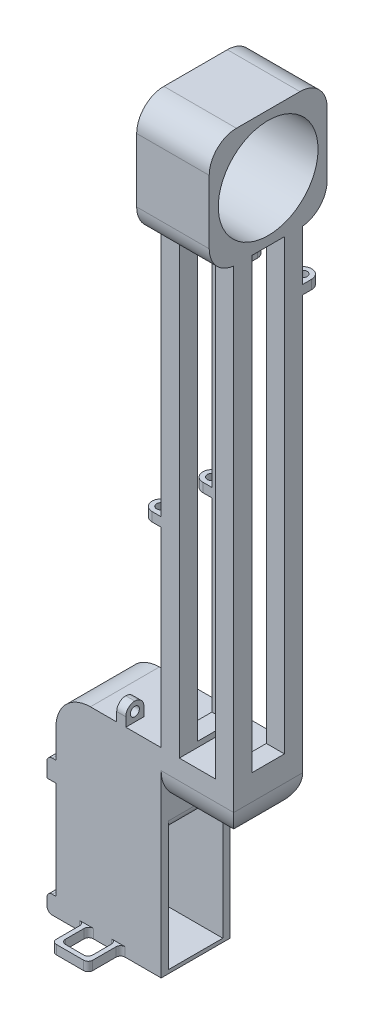
from build123d import *

# Parameters (mm, degrees)
SKETCH1_W              = 65
SKETCH1_H              = 65
SKETCH1_R              = 27.5
SKETCH1_W_2            = 38
SKETCH1_H_2            = 280
BOSS_EXTRUDE1_DEPTH    = 40
FILLET1_R              = 15
SKETCH2_W              = 58
SKETCH2_H              = 100
BOSS_EXTRUDE2_DEPTH    = 38
FILLET2_R              = 19
SKETCH3_W              = 20
SKETCH3_H              = 250
CUT_EXTRUDE1_DEPTH     = 38
SKETCH4_W              = 18
SKETCH4_H              = 247.009867417
CUT_EXTRUDE2_DEPTH     = 92
SKETCH5_W              = 28
SKETCH5_H              = 60
CUT_EXTRUDE3_DEPTH     = 58
SKETCH6_W              = 38
SKETCH6_H              = 3
BOSS_EXTRUDE11_DEPTH   = 5
BOSS_EXTRUDE11_2_DEPTH = 5
FILLET3_R              = 3
FILLET4_R              = 3
SKETCH7_W              = 10
SKETCH7_H              = 5
BOSS_EXTRUDE14_DEPTH   = 10
SKETCH8_R              = 2.5
CUT_EXTRUDE4_DEPTH     = 10
FILLET5_R              = 5
SKETCH9_W              = 10
SKETCH9_H              = 5
BOSS_EXTRUDE15_DEPTH   = 10
FILLET6_R              = 5
SKETCH10_R             = 2.5
CUT_EXTRUDE5_DEPTH     = 10
SKETCH11_W             = 5
SKETCH11_H             = 10
BOSS_EXTRUDE16_DEPTH   = 10
FILLET7_R              = 5
SKETCH12_R             = 2.5
CUT_EXTRUDE7_DEPTH     = 10
FILLET9_R              = 2
SKETCH13_W             = 35.831314296
SKETCH13_H             = 60.586089769
CUT_EXTRUDE8_DEPTH     = 10
SKETCH14_W             = 58
SKETCH14_H             = 38
CUT_EXTRUDE9_DEPTH     = 70
SKETCH15_W             = 58
SKETCH15_H             = 38
BOSS_EXTRUDE17_DEPTH   = 80
SKETCH16_W             = 34
SKETCH16_H             = 70
CUT_EXTRUDE10_DEPTH    = 58
SKETCH17_W             = 5
SKETCH17_H             = 38
BOSS_EXTRUDE18_DEPTH   = 5
SKETCH18_W             = 38
SKETCH18_H             = 10
BOSS_EXTRUDE19_DEPTH   = 5
FILLET10_R             = 3
FILLET11_R             = 5
SKETCH19_W             = 2
SKETCH19_H             = 75
BOSS_EXTRUDE22_DEPTH   = 58
SKETCH26_W             = 30
SKETCH26_H             = 9
BOSS_EXTRUDE23_DEPTH   = 58
FILLET12_R             = 5
SKETCH27_W             = 5
SKETCH27_H             = 38
BOSS_EXTRUDE24_DEPTH   = 3
BOSS_EXTRUDE26_DEPTH   = 5
FILLET13_R             = 2.5
FILLET14_R             = 2.5


# Some blends are built 0.0001 mm under size
with BuildPart() as part:
    # Sketch1 → Boss-Extrude1 (new body)
    # profile 1 of 2: a face of its own
    with BuildSketch(Plane(origin=(0, 0, 0), x_dir=(0, 0, -1), z_dir=(1, 0, 0))):
        with Locations((-32.5, -32.5)):
            Rectangle(SKETCH1_W, SKETCH1_H)
        with Locations((-32.5, -32.5)):
            Circle(SKETCH1_R, mode=Mode.SUBTRACT)
    # profile 2 of 2: a face of its own
    with BuildSketch(Plane(origin=(0, 0, 0), x_dir=(0, 0, -1), z_dir=(1, 0, 0))):
        with Locations((-32.5, -205)):
            Rectangle(SKETCH1_W_2, SKETCH1_H_2)
    extrude(amount=BOSS_EXTRUDE1_DEPTH)

    # Fillet1
    # the kernel refuses this fillet: 15 mm, written as the material it takes off along each edge
    with BuildSketch(Plane(origin=(-37.312028891, -65, 0), x_dir=(0, 1, 0), z_dir=(1, 0, 0))) as fillet1_piece_1:
        with BuildLine():
            CenterArc((14.924811557, 15), FILLET1_R, 185.739170477, 84.260829523)
            Line((0, 13.5), (-0.298496231, 13.47))
            ThreePointArc((-0.298496231, 13.47), (-0.3, 6.75), (-0.3, 0))
            Line((-0.3, 0), (0, -0.3))
            Line((0, -0.3), (14.924811557, -0.3))
            Line((14.924811557, -0.3), (14.924811557, 0))
        make_face()
    extrude(amount=114.624057783, mode=Mode.SUBTRACT)
    with BuildSketch(Plane(origin=(-37.312028891, -65, 65), x_dir=(0, 1, 0), z_dir=(1, 0, 0))) as fillet1_piece_2:
        with BuildLine():
            CenterArc((14.924811557, -15), FILLET1_R, 90, 84.260829523)
            Line((0, -13.5), (-0.298496231, -13.47))
            ThreePointArc((-0.298496231, -13.47), (-0.3, -6.75), (-0.3, 0))
            Line((-0.3, 0), (0, 0.3))
            Line((0, 0.3), (14.924811557, 0.3))
            Line((14.924811557, 0.3), (14.924811557, 0))
        make_face()
    extrude(amount=114.624057783, mode=Mode.SUBTRACT)
    with BuildSketch(Plane(origin=(-37.5, 0, 0), x_dir=(0, 0, 1), z_dir=(1, 0, 0))) as fillet1_piece_3:
        with BuildLine():
            CenterArc((FILLET1_R, FILLET1_R), FILLET1_R, 180, 90)
            Line((0, FILLET1_R), (-FILLET1_R * 0.02, FILLET1_R))
            Line((-FILLET1_R * 0.02, FILLET1_R), (-FILLET1_R * 0.02, -FILLET1_R * 0.02))
            Line((-FILLET1_R * 0.02, -FILLET1_R * 0.02), (FILLET1_R, -FILLET1_R * 0.02))
            Line((FILLET1_R, -FILLET1_R * 0.02), (FILLET1_R, 0))
        make_face()
    extrude(amount=115, mode=Mode.SUBTRACT)
    with BuildSketch(Plane(origin=(-37.5, 0, 65), x_dir=(0, 0, -1), z_dir=(1, 0, 0))) as fillet1_piece_4:
        with BuildLine():
            CenterArc((FILLET1_R, -FILLET1_R), FILLET1_R, 90, 90)
            Line((0, -FILLET1_R), (-FILLET1_R * 0.02, -FILLET1_R))
            Line((-FILLET1_R * 0.02, -FILLET1_R), (-FILLET1_R * 0.02, FILLET1_R * 0.02))
            Line((-FILLET1_R * 0.02, FILLET1_R * 0.02), (FILLET1_R, FILLET1_R * 0.02))
            Line((FILLET1_R, FILLET1_R * 0.02), (FILLET1_R, 0))
        make_face()
    extrude(amount=115, mode=Mode.SUBTRACT)

    # Sketch2 → Boss-Extrude2 (add)
    with BuildSketch(Plane.XY.offset(51.5)):
        with Locations((-29, -365)):
            Rectangle(SKETCH2_W, SKETCH2_H)
    extrude(amount=-BOSS_EXTRUDE2_DEPTH)

    # Fillet2
    # the kernel refuses this fillet: 19 mm, written as the material it adds along each edge
    # the kernel refuses this fillet: 19 mm, written as the material it takes off along each edge
    with BuildSketch(Plane(origin=(0, -345, 13.5), x_dir=(0, 1, 0), z_dir=(1, 0, 0))) as fillet2_2_piece_1:
        with BuildLine():
            CenterArc((FILLET2_R, FILLET2_R), FILLET2_R, 180, 90)
            Line((0, FILLET2_R), (0, 0))
            Line((0, 0), (FILLET2_R, 0))
        make_face()
    extrude(amount=87.5, mode=Mode.SUBTRACT)
    with BuildSketch(Plane(origin=(0, -345, 51.5), x_dir=(0, 1, 0), z_dir=(1, 0, 0))) as fillet2_2_piece_2:
        with BuildLine():
            CenterArc((FILLET2_R, -FILLET2_R), FILLET2_R, 90, 90)
            Line((0, -FILLET2_R), (0, 0))
            Line((0, 0), (FILLET2_R, 0))
        make_face()
    extrude(amount=87.5, mode=Mode.SUBTRACT)
    with BuildSketch(Plane(origin=(40, -345, -34), x_dir=(0, 1, 0), z_dir=(0, 0, 1)), Plane(origin=(-58, -315, 99), x_dir=(1, 0, 0), z_dir=(0, 0, -1))) as fillet2_2_piece_3:
        with BuildLine():
            CenterArc((FILLET2_R, FILLET2_R), FILLET2_R, 180, 90)
            Line((0, FILLET2_R), (0, 0))
            Line((0, 0), (FILLET2_R, 0))
        make_face()
    extrude(amount=133, mode=Mode.SUBTRACT)

    # Sketch3 → Cut-Extrude1 (cut)
    with BuildSketch(Plane.XY.offset(51.5)):
        with Locations((20, -190)):
            Rectangle(SKETCH3_W, SKETCH3_H)
    extrude(amount=-CUT_EXTRUDE1_DEPTH, mode=Mode.SUBTRACT)

    # Sketch4 → Cut-Extrude2 (cut)
    with BuildSketch(Plane(origin=(40, 0, 0), x_dir=(0, 0, -1), z_dir=(1, 0, 0))):
        with Locations((-32.5, -188.504933709)):
            Rectangle(SKETCH4_W, SKETCH4_H)
    extrude(amount=-CUT_EXTRUDE2_DEPTH, mode=Mode.SUBTRACT)

    # Sketch5 → Cut-Extrude3 (cut)
    with BuildSketch(Plane(origin=(0, 0, 0), x_dir=(0, 0, -1), z_dir=(1, 0, 0))):
        with Locations((-32.5, -380)):
            Rectangle(SKETCH5_W, SKETCH5_H)
    extrude(amount=-CUT_EXTRUDE3_DEPTH, mode=Mode.SUBTRACT)

    # Sketch7 → Boss-Extrude14 (add)
    with BuildSketch(Plane.ZY):
        with Locations((18.5, -207.271752894)):
            Rectangle(SKETCH7_W, SKETCH7_H)
        with Locations((46.5, -207.271752894)):
            Rectangle(SKETCH7_W, SKETCH7_H)
    extrude(amount=BOSS_EXTRUDE14_DEPTH)

    # Sketch8 → Cut-Extrude4 (cut)
    with BuildSketch(Plane.XZ.offset(209.771752894)):
        with Locations(Location((-5, 18.5, 0), (0, 0, 270))):
            Circle(SKETCH8_R)
        with Locations(Location((-5, 46.5, 0), (0, 0, 270))):
            Circle(SKETCH8_R)
    extrude(amount=-CUT_EXTRUDE4_DEPTH, mode=Mode.SUBTRACT)

    # Fillet5
    fillet5_edges = [part.edges().sort_by_distance(p)[0] for p in [
        (-10, -207.271752894, 23.5),
        (-10, -207.271752894, 51.5),
        (-10, -207.271752894, 41.5),
        (-10, -207.271752894, 13.5),
    ]]
    fillet(fillet5_edges, radius=FILLET5_R - 0.0001)  # a hair under: the kernel refuses the full size

    # Sketch9 → Boss-Extrude15 (add)
    with BuildSketch(Plane(origin=(0, 0, 13.5), x_dir=(-1, 0, 0), z_dir=(0, 0, -1))):
        with Locations((-35, -95.328363794)):
            Rectangle(SKETCH9_W, SKETCH9_H)
        with Locations((-5, -95.328363794)):
            Rectangle(SKETCH9_W, SKETCH9_H)
    extrude(amount=BOSS_EXTRUDE15_DEPTH)

    # Fillet6
    fillet6_edges = [part.edges().sort_by_distance(p)[0] for p in [
        (40, -95.328363794, 3.5),
        (30, -95.328363794, 3.5),
        (10, -95.328363794, 3.5),
        (0, -95.328363794, 3.5),
    ]]
    fillet(fillet6_edges, radius=FILLET6_R - 0.0001)  # a hair under: the kernel refuses the full size

    # Sketch10 → Cut-Extrude5 (cut)
    with BuildSketch(Plane(origin=(0, -97.828363794, 0), x_dir=(-1, 0, 0), z_dir=(0, -1, 0))):
        with Locations(Location((-35, -8.5, 0), (0, 0, 90))):
            Circle(SKETCH10_R)
        with Locations(Location((-5, -8.5, 0), (0, 0, 90))):
            Circle(SKETCH10_R)
    extrude(amount=-CUT_EXTRUDE5_DEPTH, mode=Mode.SUBTRACT)

    # Sketch11 → Boss-Extrude16 (add)
    with BuildSketch(Plane(origin=(0, -315, 0), x_dir=(1, 0, 0), z_dir=(0, 1, 0))):
        with Locations((-22, -18.5)):
            Rectangle(SKETCH11_W, SKETCH11_H)
        with Locations((-22, -46.5)):
            Rectangle(SKETCH11_W, SKETCH11_H)
    extrude(amount=BOSS_EXTRUDE16_DEPTH)

    # Fillet7
    fillet7_edges = [part.edges().sort_by_distance(p)[0] for p in [
        (-22, -305, 51.5),
        (-22, -305, 13.5),
        (-22, -305, 41.5),
        (-22, -305, 23.5),
    ]]
    fillet(fillet7_edges, radius=FILLET7_R - 0.0001)  # a hair under: the kernel refuses the full size

    # Sketch12 → Cut-Extrude7 (cut)
    with BuildSketch(Plane.ZY.offset(24.5)):
        with Locations((18.5, -310)):
            Circle(SKETCH12_R)
        with Locations((46.5, -310)):
            Circle(SKETCH12_R)
    extrude(amount=-CUT_EXTRUDE7_DEPTH, mode=Mode.SUBTRACT)

    # Fillet9
    fillet9_edges = [part.edges().sort_by_distance(p)[0] for p in [
        (0, -410, 32.5),
        (0, -350, 32.5),
    ]]
    fillet(fillet9_edges, radius=FILLET9_R)

    # Sketch14 → Cut-Extrude9 (cut)
    with BuildSketch(Plane(origin=(0, -415, 0), x_dir=(-1, 0, 0), z_dir=(0, -1, 0))):
        with Locations((29, -32.5)):
            Rectangle(SKETCH14_W, SKETCH14_H)
    extrude(amount=-CUT_EXTRUDE9_DEPTH, mode=Mode.SUBTRACT)



with BuildPart() as body_2:
    # Sketch6 → Boss-Extrude11 (new body)
    with BuildSketch(Plane.ZY.offset(58)):
        with Locations((32.5, -351.5)):
            Rectangle(SKETCH6_W, SKETCH6_H)
    extrude(amount=BOSS_EXTRUDE11_DEPTH)

    # Fillet3
    fillet3_edges = [body_2.edges().sort_by_distance(p)[0] for p in [
        (-63, -350, 32.5),
    ]]
    fillet(fillet3_edges, radius=FILLET3_R - 0.0001)  # a hair under: the kernel refuses the full size


with BuildPart() as body_3:
    # Sketch6 → Boss-Extrude11 2 (new body)
    with BuildSketch(Plane.ZY.offset(58)):
        with Locations((32.5, -408.5)):
            Rectangle(SKETCH6_W, SKETCH6_H)
    extrude(amount=BOSS_EXTRUDE11_2_DEPTH)

    # Fillet4
    fillet4_edges = [body_3.edges().sort_by_distance(p)[0] for p in [
        (-63, -410, 32.5),
    ]]
    fillet(fillet4_edges, radius=FILLET4_R - 0.0001)  # a hair under: the kernel refuses the full size

    # Sketch13 → Cut-Extrude8 (cut)
    with BuildSketch(Plane.XZ.offset(410)):
        with Locations((-75.915657148, 21.206955116)):
            Rectangle(SKETCH13_W, SKETCH13_H)
    extrude(amount=-CUT_EXTRUDE8_DEPTH, mode=Mode.SUBTRACT)


with BuildPart() as part_1:
    add(part.part)

    add(body_2.part)  # Boss-Extrude17 merges body 2
    # Sketch15 → Boss-Extrude17 (add)
    with BuildSketch(Plane(origin=(0, -345, 0), x_dir=(-1, 0, 0), z_dir=(0, -1, 0))):
        with Locations((29, -32.5)):
            Rectangle(SKETCH15_W, SKETCH15_H)
    extrude(amount=BOSS_EXTRUDE17_DEPTH)

    # Sketch16 → Cut-Extrude10 (cut)
    with BuildSketch(Plane(origin=(0, 0, 0), x_dir=(0, 0, -1), z_dir=(1, 0, 0))):
        with Locations((-32.5, -388)):
            Rectangle(SKETCH16_W, SKETCH16_H)
    extrude(amount=-CUT_EXTRUDE10_DEPTH, mode=Mode.SUBTRACT)

    # Sketch17 → Boss-Extrude18 (add)
    with BuildSketch(Plane.XZ.offset(353)):
        with Locations((-60.5, 32.5)):
            Rectangle(SKETCH17_W, SKETCH17_H)
    extrude(amount=BOSS_EXTRUDE18_DEPTH)

    # Sketch18 → Boss-Extrude19 (add)
    with BuildSketch(Plane.ZY.offset(58)):
        with Locations((32.5, -420)):
            Rectangle(SKETCH18_W, SKETCH18_H)
    extrude(amount=BOSS_EXTRUDE19_DEPTH)

    # Fillet10
    fillet10_edges = [part_1.edges().sort_by_distance(p)[0] for p in [
        (-63, -415, 32.5),
        (-63, -425, 32.5),
    ]]
    fillet(fillet10_edges, radius=FILLET10_R)

    # Fillet11
    fillet11_edges = [part_1.edges().sort_by_distance(p)[0] for p in [
        (0, -353, 32.5),
    ]]
    fillet(fillet11_edges, radius=FILLET11_R)

    # Sketch19 → Boss-Extrude22 (add)
    with BuildSketch(Plane(origin=(0, 0, 0), x_dir=(0, 0, -1), z_dir=(1, 0, 0))):
        with Locations((-48.5, -385.5)):
            Rectangle(SKETCH19_W, SKETCH19_H)
        with Locations((-16.5, -385.5)):
            Rectangle(SKETCH19_W, SKETCH19_H)
    extrude(amount=-BOSS_EXTRUDE22_DEPTH)

    # Sketch26 → Boss-Extrude23 (add)
    with BuildSketch(Plane(origin=(0, 0, 0), x_dir=(0, 0, -1), z_dir=(1, 0, 0))):
        with Locations((-32.5, -352.5)):
            Rectangle(SKETCH26_W, SKETCH26_H)
    extrude(amount=-BOSS_EXTRUDE23_DEPTH)

    # Fillet12
    fillet12_edges = [part_1.edges().sort_by_distance(p)[0] for p in [
        (0, -357, 32.5),
    ]]
    fillet(fillet12_edges, radius=FILLET12_R)

    # Sketch27 → Boss-Extrude24 (add)
    with BuildSketch(Plane.XZ.offset(358)):
        with Locations((-60.5, 32.5)):
            Rectangle(SKETCH27_W, SKETCH27_H)
    extrude(amount=BOSS_EXTRUDE24_DEPTH)

    # Sketch30 → Boss-Extrude26 (add)
    with BuildSketch(Plane(origin=(0, -425, 0), x_dir=(-1, 0, 0), z_dir=(0, -1, 0))):
        Polygon((24.87431458, -51.5), (22.37431458, -51.5), (22.37431458, -69.364525512), (42.423825194, -69.364525512), (42.423825194, -51.5), (39.923825194, -51.5), (39.923825194, -66.864525512), (24.87431458, -66.864525512), align=None)
    extrude(amount=-BOSS_EXTRUDE26_DEPTH)

    # Fillet13
    fillet13_edges = [part_1.edges().sort_by_distance(p)[0] for p in [
        (-24.87431458, -422.5, 51.5),
        (-39.923825194, -422.5, 51.5),
        (-42.423825194, -422.5, 51.5),
        (-42.423825194, -422.5, 69.364525512),
        (-22.37431458, -422.5, 69.364525512),
        (-22.37431458, -422.5, 51.5),
    ]]
    fillet(fillet13_edges, radius=FILLET13_R)

    # Fillet14
    fillet14_edges = [part_1.edges().sort_by_distance(p)[0] for p in [
        (-24.87431458, -422.5, 66.864525512),
        (-39.923825194, -422.5, 66.864525512),
    ]]
    fillet(fillet14_edges, radius=FILLET14_R)


solid = part_1.part
